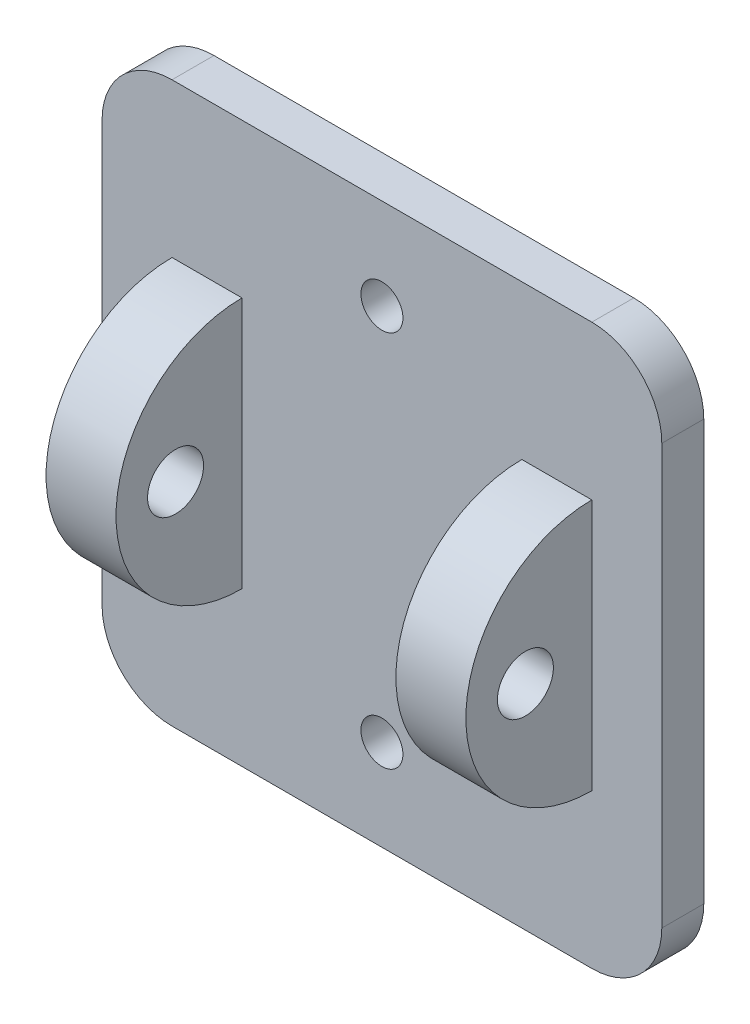
from build123d import *

# Parameters (mm, degrees)
CROQUIS1_R              = 1.5
SALIENTE_EXTRUIR1_DEPTH = 3
SALIENTE_EXTRUIR2_START = 3
CROQUIS2_W              = 5
CROQUIS2_H              = 18
SALIENTE_EXTRUIR2_DEPTH = 9
REDONDEO6_R             = 9
REDONDEO7_R             = 9
CORTAR_EXTRUIR1_REACH   = 47.338
CROQUIS3_R              = 2


with BuildPart() as part:
    # Croquis1 → Saliente-Extruir1 (new body)
    with BuildSketch(Plane.XY):
        with BuildLine():
            Line((-7.68763367, 13.798076923), (22.31236633, 13.798076923))
            ThreePointArc((22.31236633, 13.798076923), (25.847900236, 12.333610829), (27.31236633, 8.798076923))
            Line((27.31236633, 8.798076923), (27.31236633, -21.201923077))
            ThreePointArc((27.31236633, -21.201923077), (25.847900236, -24.737456983), (22.31236633, -26.201923077))
            Line((22.31236633, -26.201923077), (-7.68763367, -26.201923077))
            ThreePointArc((-7.68763367, -26.201923077), (-11.223167576, -24.737456983), (-12.68763367, -21.201923077))
            Line((-12.68763367, -21.201923077), (-12.68763367, 8.798076923))
            ThreePointArc((-12.68763367, 8.798076923), (-11.223167576, 12.333610829), (-7.68763367, 13.798076923))
        make_face()
        with Locations((7.31236633, 7.298076923)):
            Circle(CROQUIS1_R, mode=Mode.SUBTRACT)
        with Locations((7.31236633, -19.701923077)):
            Circle(CROQUIS1_R, mode=Mode.SUBTRACT)
    extrude(amount=SALIENTE_EXTRUIR1_DEPTH)

    # Croquis2 → Saliente-Extruir2 (add)
    with BuildSketch(Plane.XY.offset(SALIENTE_EXTRUIR2_START)):
        with Locations((-5.18763367, -6.201923077)):
            Rectangle(CROQUIS2_W, CROQUIS2_H)
        with Locations((19.81236633, -6.201923077)):
            Rectangle(CROQUIS2_W, CROQUIS2_H)
    extrude(amount=SALIENTE_EXTRUIR2_DEPTH)

    # Redondeo6
    redondeo6_edges = [part.edges().sort_by_distance(p)[0] for p in [
        (-5.18763367, 2.798076923, 12),
        (-5.18763367, -15.201923077, 12),
    ]]
    fillet(redondeo6_edges, radius=REDONDEO6_R - 0.0001)  # a hair under: the kernel refuses the full size

    # Redondeo7
    redondeo7_edges = [part.edges().sort_by_distance(p)[0] for p in [
        (19.81236633, -15.201923077, 12),
        (19.81236633, 2.798076923, 12),
    ]]
    fillet(redondeo7_edges, radius=REDONDEO7_R - 0.0001)  # a hair under: the kernel refuses the full size

    # Cortar-Extruir1: up to this face of the body (flat: up to its plane)
    cortar_extruir1_end = Plane(part.part.faces().sort_by_distance((22.31236633, -6.201923077, 6.819731779))[0])
    # Croquis3 → Cortar-Extruir1 (cut, up to the picked face)
    with BuildSketch(Plane.ZY.offset(7.68763367), mode=Mode.PRIVATE) as cortar_extruir1_sk1:
        with Locations((7.74625312, -6.201923077)):
            Circle(CROQUIS3_R)
    cortar_extruir1_tool1 = split(extrude(cortar_extruir1_sk1.sketch, amount=-CORTAR_EXTRUIR1_REACH, mode=Mode.PRIVATE), bisect_by=cortar_extruir1_end, keep=Keep.BOTH, mode=Mode.PRIVATE)
    add(cortar_extruir1_tool1.solids().sort_by(Axis((-7.687634, -6.201923, 7.746253), (1, 0, 0)))[0], mode=Mode.SUBTRACT)


solid = part.part
